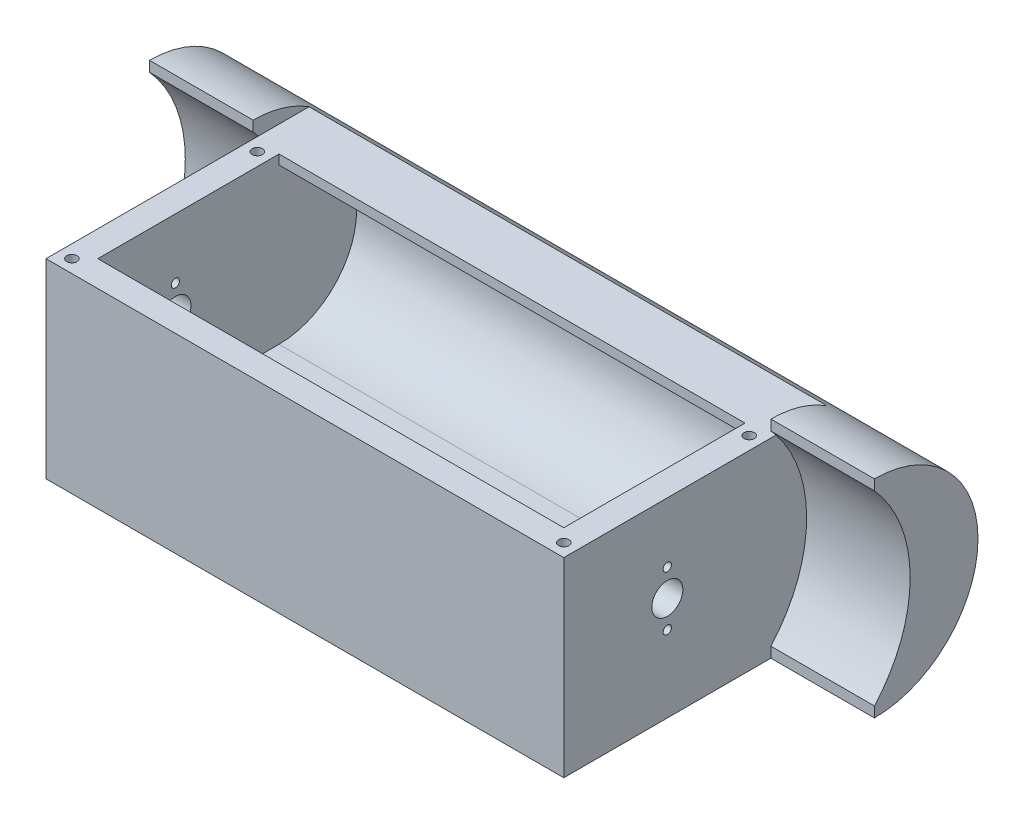
from build123d import *

# Parameters (mm, degrees)
BOSS_EXTRUDE1_DEPTH = 100
SHELL3_START        = 5
SHELL3_DEPTH        = 90
BOSS_EXTRUDE2_DEPTH = 20
SKETCH7_W           = 100
SKETCH7_H           = 50.81
CUT_EXTRUDE6_DEPTH  = 3.175
CUT_EXTRUDE1_REACH  = 130.062
SKETCH2_R           = 0.8
SKETCH2_R_2         = 3
SKETCH8_R           = 1
CUT_EXTRUDE7_DEPTH  = 3
CUT_EXTRUDE8_DEPTH  = 20
CUT_EXTRUDE9_START  = -20
CUT_EXTRUDE9_DEPTH  = 20


# Read off the part's stored shape, not the designer's step: Shell3
with BuildPart() as part:
    # Sketch1 → Boss-Extrude1 (new body)
    with BuildSketch(Plane(origin=(0, 0, 0), x_dir=(0, 0, -1), z_dir=(1, 0, 0))):
        with BuildLine():
            Line((-20, 20), (20, 20))
            ThreePointArc((20, 20), (40, 0), (20, -20))
            Line((20, -20), (-20, -20))
            Line((-20, -20), (-20, 20))
        make_face()
    extrude(amount=BOSS_EXTRUDE1_DEPTH)

    # Shell3 outline → Shell3 (cut)
    with BuildSketch(Plane.YZ.offset(SHELL3_START)):
        with BuildLine():
            Line((15, -20), (20, -20))
            Line((20, -20), (20, 15))
            Line((20, 15), (-15, 15))
            Line((-15, 15), (-15, -20))
            ThreePointArc((-15, -20), (0, -35), (15, -20))
        make_face()
    extrude(amount=SHELL3_DEPTH, mode=Mode.SUBTRACT)

    # Sketch9 → Boss-Extrude2 (add)
    with BuildSketch(Plane(origin=(100, 0, 0), x_dir=(0, 0, -1), z_dir=(1, 0, 0))):
        with BuildLine():
            Line((20, 20), (20, -20))
            ThreePointArc((20, -20), (40, 0), (20, 20))
        make_face()
    boss_extrude2 = extrude(amount=BOSS_EXTRUDE2_DEPTH)

    # Mirror1: Boss-Extrude2 across plane
    add(boss_extrude2.mirror(Plane(origin=(50, 0, 0), x_dir=(0, 0, 1), z_dir=(1, 0, 0))))

    # Sketch7 → Cut-Extrude6 (cut)
    with BuildSketch(Plane(origin=(0, 20, 0), x_dir=(1, 0, 0), z_dir=(0, 1, 0))):
        with Locations((50, 5.405)):
            Rectangle(SKETCH7_W, SKETCH7_H)
    extrude(amount=-CUT_EXTRUDE6_DEPTH, mode=Mode.SUBTRACT)

    # Cut-Extrude1: up to this face of the body (flat: up to its plane)
    cut_extrude1_end = Plane(part.part.faces().sort_by_distance((0, -1.5875, 0))[0])
    # Sketch2 → Cut-Extrude1 (cut, up to the picked face)
    with BuildSketch(Plane(origin=(100, 0, 0), x_dir=(0, 0, -1), z_dir=(1, 0, 0)), mode=Mode.PRIVATE) as cut_extrude1_sk1:
        with Locations(Location((0, -5.25, 0), (0, 0, 180))):
            Circle(SKETCH2_R)
    cut_extrude1_tool1 = split(extrude(cut_extrude1_sk1.sketch, amount=-CUT_EXTRUDE1_REACH, mode=Mode.PRIVATE), bisect_by=cut_extrude1_end, keep=Keep.BOTH, mode=Mode.PRIVATE)
    # Sketch2 → Cut-Extrude1 (cut, up to the picked face)
    with BuildSketch(Plane(origin=(100, 0, 0), x_dir=(0, 0, -1), z_dir=(1, 0, 0)), mode=Mode.PRIVATE) as cut_extrude1_sk2:
        with Locations(Location((0, 0, 0), (0, 0, 180))):
            Circle(SKETCH2_R_2)
    cut_extrude1_tool2 = split(extrude(cut_extrude1_sk2.sketch, amount=-CUT_EXTRUDE1_REACH, mode=Mode.PRIVATE), bisect_by=cut_extrude1_end, keep=Keep.BOTH, mode=Mode.PRIVATE)
    # Sketch2 → Cut-Extrude1 (cut, up to the picked face)
    with BuildSketch(Plane(origin=(100, 0, 0), x_dir=(0, 0, -1), z_dir=(1, 0, 0)), mode=Mode.PRIVATE) as cut_extrude1_sk3:
        with Locations(Location((0, 5.25, 0), (0, 0, 180))):
            Circle(SKETCH2_R)
    cut_extrude1_tool3 = split(extrude(cut_extrude1_sk3.sketch, amount=-CUT_EXTRUDE1_REACH, mode=Mode.PRIVATE), bisect_by=cut_extrude1_end, keep=Keep.BOTH, mode=Mode.PRIVATE)
    add(cut_extrude1_tool1.solids().sort_by(Axis((100, -5.25, 0), (-1, 0, 0)))[0], mode=Mode.SUBTRACT)
    add(cut_extrude1_tool2.solids().sort_by(Axis((100, 0, 0), (-1, 0, 0)))[0], mode=Mode.SUBTRACT)
    add(cut_extrude1_tool3.solids().sort_by(Axis((100, 5.25, 0), (-1, 0, 0)))[0], mode=Mode.SUBTRACT)

    # Sketch8 → Cut-Extrude7 (cut)
    with BuildSketch(Plane(origin=(0, 16.825, 0), x_dir=(1, 0, 0), z_dir=(0, 1, 0))):
        with Locations(Location((97.5, -17.5, 0), (0, 0, 270))):
            Circle(SKETCH8_R)
        with Locations(Location((97.5, 18.31, 0), (0, 0, 270))):
            Circle(SKETCH8_R)
        with Locations(Location((2.5, -17.5, 0), (0, 0, 90))):
            Circle(SKETCH8_R)
        with Locations(Location((2.5, 18.31, 0), (0, 0, 90))):
            Circle(SKETCH8_R)
    extrude(amount=-CUT_EXTRUDE7_DEPTH, mode=Mode.SUBTRACT)

    # Sketch10 → Cut-Extrude8 (cut)
    with BuildSketch(Plane(origin=(120, 0, 0), x_dir=(0, 0, -1), z_dir=(1, 0, 0))):
        with BuildLine():
            Line((20, 17.989163405), (20, -17.989163405))
            ThreePointArc((20, -17.989163405), (26.9, 0), (20, 17.989163405))
        make_face()
    extrude(amount=-CUT_EXTRUDE8_DEPTH, mode=Mode.SUBTRACT)

    # Sketch11 → Cut-Extrude9 (cut)
    with BuildSketch(Plane.ZY.offset(20).offset(CUT_EXTRUDE9_START)):
        with BuildLine():
            Line((-20, 17.989163405), (-20, -17.989163405))
            ThreePointArc((-20, -17.989163405), (-26.9, 0), (-20, 17.989163405))
        make_face()
    extrude(amount=CUT_EXTRUDE9_DEPTH, mode=Mode.SUBTRACT)


solid = part.part
